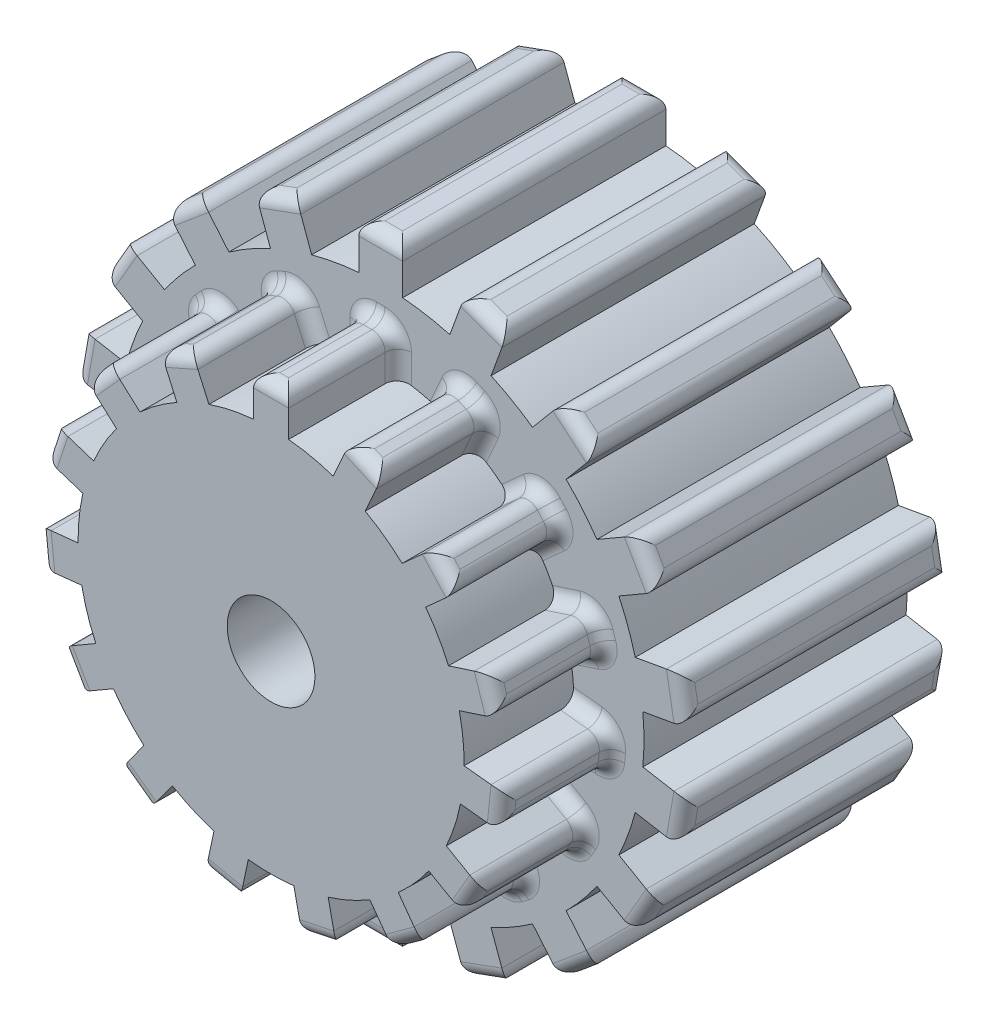
from build123d import *

# Parameters (mm, degrees)
SKETCH2_R                = 60
BOSS_EXTRUDE1_DEPTH      = 60
SKETCH3_W                = 10
SKETCH3_H                = 10.47851478
BOSS_EXTRUDE2_DEPTH      = 60
FILLET2_R                = 3
CIRPATTERN1_COUNT        = 18
FILLET2_OF_CIRPATTERN1_R = 3
SKETCH4_R                = 10
CUT_EXTRUDE1_DEPTH       = 60
SKETCH5_R                = 44
BOSS_EXTRUDE3_DEPTH      = 25
SKETCH6_W                = 8
SKETCH6_H                = 10.044359629
BOSS_EXTRUDE4_DEPTH      = 25
CUT_EXTRUDE2_START       = -90
SKETCH7_R                = 10
CUT_EXTRUDE2_DEPTH       = 90
FILLET3_R                = 3
CIRPATTERN2_COUNT        = 15
FILLET3_OF_CIRPATTERN2_R = 3


with BuildPart() as part:
    # Sketch2 → Boss-Extrude1 (new body)
    with BuildSketch(Plane.XY):
        Circle(SKETCH2_R)
    extrude(amount=BOSS_EXTRUDE1_DEPTH)

    # Sketch3 → Boss-Extrude2 (add)
    with BuildSketch(Plane.XY.offset(60)):
        with Locations((0, 64.76074261)):
            Rectangle(SKETCH3_W, SKETCH3_H)
    boss_extrude2 = extrude(amount=-BOSS_EXTRUDE2_DEPTH)

    # Fillet2
    fillet2_edges = [part.edges().sort_by_distance(p)[0] for p in [
        (-5, 70, 30),
        (0, 70, 0),
        (5, 70, 30),
        (0, 70, 60),
    ]]
    fillet(fillet2_edges, radius=FILLET2_R)

    # CirPattern1: Boss-Extrude2 ×18 about axis
    cirpattern1_axis = Axis((0, 0, 60), (0, 0, -1))
    for i in range(1, CIRPATTERN1_COUNT):
        add(boss_extrude2.rotate(cirpattern1_axis, i * 360 / CIRPATTERN1_COUNT))

    # Fillet2 of CirPattern1
    fillet2_of_cirpattern1_edges = [part.edges().sort_by_distance(p)[0] for p in [
        (19.242946929, 67.488584172, 30),
        (23.941410033, 65.778483455, 0),
        (28.639873137, 64.068382738, 30),
        (23.941410033, 65.778483455, 60),
        (41.164910462, 56.837049067, 30),
        (44.995132678, 53.623111018, 0),
        (48.825354894, 50.40917297, 30),
        (44.995132678, 53.623111018, 60),
        (58.121778265, 39.330127019, 30),
        (60.621778265, 35, 0),
        (63.121778265, 30.669872981, 30),
        (60.621778265, 35, 60),
        (68.068301823, 17.079411202, 30),
        (68.936542711, 12.155372437, 0),
        (69.804783599, 7.231333672, 30),
        (68.936542711, 12.155372437, 60),
        (69.804783599, -7.231333672, 30),
        (68.936542711, -12.155372437, 0),
        (68.068301823, -17.079411202, 30),
        (68.936542711, -12.155372437, 60),
        (63.121778265, -30.669872981, 30),
        (60.621778265, -35, 0),
        (58.121778265, -39.330127019, 30),
        (60.621778265, -35, 60),
        (48.825354894, -50.40917297, 30),
        (44.995132678, -53.623111018, 0),
        (41.164910462, -56.837049067, 30),
        (44.995132678, -53.623111018, 60),
        (28.639873137, -64.068382738, 30),
        (23.941410033, -65.778483455, 0),
        (19.242946929, -67.488584172, 30),
        (23.941410033, -65.778483455, 60),
        (5, -70, 30),
        (0, -70, 0),
        (-5, -70, 30),
        (0, -70, 60),
        (-19.242946929, -67.488584172, 30),
        (-23.941410033, -65.778483455, 0),
        (-28.639873137, -64.068382738, 30),
        (-23.941410033, -65.778483455, 60),
        (-41.164910462, -56.837049067, 30),
        (-44.995132678, -53.623111018, 0),
        (-48.825354894, -50.40917297, 30),
        (-44.995132678, -53.623111018, 60),
        (-58.121778265, -39.330127019, 30),
        (-60.621778265, -35, 0),
        (-63.121778265, -30.669872981, 30),
        (-60.621778265, -35, 60),
        (-68.068301823, -17.079411202, 30),
        (-68.936542711, -12.155372437, 0),
        (-69.804783599, -7.231333672, 30),
        (-68.936542711, -12.155372437, 60),
        (-69.804783599, 7.231333672, 30),
        (-68.936542711, 12.155372437, 0),
        (-68.068301823, 17.079411202, 30),
        (-68.936542711, 12.155372437, 60),
        (-63.121778265, 30.669872981, 30),
        (-60.621778265, 35, 0),
        (-58.121778265, 39.330127019, 30),
        (-60.621778265, 35, 60),
        (-48.825354894, 50.40917297, 30),
        (-44.995132678, 53.623111018, 0),
        (-41.164910462, 56.837049067, 30),
        (-44.995132678, 53.623111018, 60),
        (-28.639873137, 64.068382738, 30),
        (-23.941410033, 65.778483455, 0),
        (-19.242946929, 67.488584172, 30),
        (-23.941410033, 65.778483455, 60),
    ]]
    fillet(fillet2_of_cirpattern1_edges, radius=FILLET2_OF_CIRPATTERN1_R)

    # Sketch4 → Cut-Extrude1 (cut)
    with BuildSketch(Plane.XY.offset(60)):
        Circle(SKETCH4_R)
    extrude(amount=-CUT_EXTRUDE1_DEPTH, mode=Mode.SUBTRACT)

    # Sketch5 → Boss-Extrude3 (add)
    with BuildSketch(Plane.XY.offset(60)):
        Circle(SKETCH5_R)
    extrude(amount=BOSS_EXTRUDE3_DEPTH)

    # Sketch6 → Boss-Extrude4 (add)
    with BuildSketch(Plane.XY.offset(85)):
        with Locations((0, 47.977820186)):
            Rectangle(SKETCH6_W, SKETCH6_H)
    boss_extrude4 = extrude(amount=-BOSS_EXTRUDE4_DEPTH)

    # Sketch7 → Cut-Extrude2 (cut)
    with BuildSketch(Plane(origin=(0, 0, 0), x_dir=(-1, 0, 0), z_dir=(0, 0, -1)).offset(CUT_EXTRUDE2_START)):
        Circle(SKETCH7_R)
    extrude(amount=CUT_EXTRUDE2_DEPTH, mode=Mode.SUBTRACT)

    # Fillet3
    fillet3_edges = [part.edges().sort_by_distance(p)[0] for p in [
        (-4, 48.4089023, 60),
        (4, 48.4089023, 60),
        (-4, 53, 72.5),
        (0, 53, 60),
        (4, 53, 72.5),
        (0, 53, 85),
    ]]
    fillet(fillet3_edges, radius=FILLET3_R)

    # CirPattern2: Boss-Extrude4 ×15 about axis
    cirpattern2_axis = Axis((0, 0, 85), (0, 0, -1))
    for i in range(1, CIRPATTERN2_COUNT):
        add(boss_extrude4.rotate(cirpattern2_axis, i * 360 / CIRPATTERN2_COUNT))

    # Fillet3 of CirPattern2
    fillet3_of_cirpattern2_edges = [part.edges().sort_by_distance(p)[0] for p in [
        (16.035492586, 45.850679378, 60),
        (23.343856247, 42.596786234, 60),
        (17.902860252, 50.044855827, 72.5),
        (21.557042083, 48.417909255, 60),
        (25.211223914, 46.790962683, 72.5),
        (21.557042083, 48.417909255, 85),
        (33.298302826, 35.364457451, 60),
        (38.651347677, 29.419298847, 60),
        (36.710153325, 38.436501439, 72.5),
        (39.38667575, 35.463922137, 60),
        (42.063198176, 32.491342835, 72.5),
        (39.38667575, 35.463922137, 85),
        (44.803534002, 18.763399555, 60),
        (47.275669957, 11.154947425, 60),
        (49.169927386, 20.182126767, 72.5),
        (50.405995364, 16.377900702, 60),
        (51.642063341, 12.573674637, 72.5),
        (50.405995364, 16.377900702, 85),
        (48.561827121, -1.082020584, 60),
        (47.725599415, -9.038195747, 60),
        (53.127774308, -1.561920972, 72.5),
        (52.709660455, -5.540008553, 60),
        (52.291546601, -9.518096135, 72.5),
        (52.709660455, -5.540008553, 85),
        (43.923339161, -20.740349535, 60),
        (39.923339161, -27.668552765, 60),
        (47.899346401, -23.035898385, 72.5),
        (45.899346401, -26.5, 60),
        (43.899346401, -29.964101615, 72.5),
        (45.899346401, -26.5, 85),
        (31.690106829, -36.812483631, 60),
        (25.217970874, -41.514765649, 60),
        (34.388686349, -40.526759693, 72.5),
        (31.152618372, -42.877900702, 60),
        (27.916550394, -45.229041711, 72.5),
        (31.152618372, -42.877900702, 85),
        (13.977367131, -46.519404876, 60),
        (6.152186325, -48.182698402, 60),
        (14.931910016, -51.010176076, 72.5),
        (11.019319613, -51.841822839, 60),
        (7.10672921, -52.673469602, 72.5),
        (11.019319613, -51.841822839, 85),
        (-6.152186325, -48.182698402, 60),
        (-13.977367131, -46.519404876, 60),
        (-7.10672921, -52.673469602, 72.5),
        (-11.019319613, -51.841822839, 60),
        (-14.931910016, -51.010176076, 72.5),
        (-11.019319613, -51.841822839, 85),
        (-25.217970874, -41.514765649, 60),
        (-31.690106829, -36.812483631, 60),
        (-27.916550394, -45.229041711, 72.5),
        (-31.152618372, -42.877900702, 60),
        (-34.388686349, -40.526759693, 72.5),
        (-31.152618372, -42.877900702, 85),
        (-39.923339161, -27.668552765, 60),
        (-43.923339161, -20.740349535, 60),
        (-43.899346401, -29.964101615, 72.5),
        (-45.899346401, -26.5, 60),
        (-47.899346401, -23.035898385, 72.5),
        (-45.899346401, -26.5, 85),
        (-47.725599415, -9.038195747, 60),
        (-48.561827121, -1.082020584, 60),
        (-52.291546601, -9.518096135, 72.5),
        (-52.709660455, -5.540008553, 60),
        (-53.127774308, -1.561920972, 72.5),
        (-52.709660455, -5.540008553, 85),
        (-47.275669957, 11.154947425, 60),
        (-44.803534002, 18.763399555, 60),
        (-51.642063341, 12.573674637, 72.5),
        (-50.405995364, 16.377900702, 60),
        (-49.169927386, 20.182126767, 72.5),
        (-50.405995364, 16.377900702, 85),
        (-38.651347677, 29.419298847, 60),
        (-33.298302826, 35.364457451, 60),
        (-42.063198176, 32.491342835, 72.5),
        (-39.38667575, 35.463922137, 60),
        (-36.710153325, 38.436501439, 72.5),
        (-39.38667575, 35.463922137, 85),
        (-23.343856247, 42.596786234, 60),
        (-16.035492586, 45.850679378, 60),
        (-25.211223914, 46.790962683, 72.5),
        (-21.557042083, 48.417909255, 60),
        (-17.902860252, 50.044855827, 72.5),
        (-21.557042083, 48.417909255, 85),
    ]]
    fillet(fillet3_of_cirpattern2_edges, radius=FILLET3_OF_CIRPATTERN2_R)


solid = part.part
